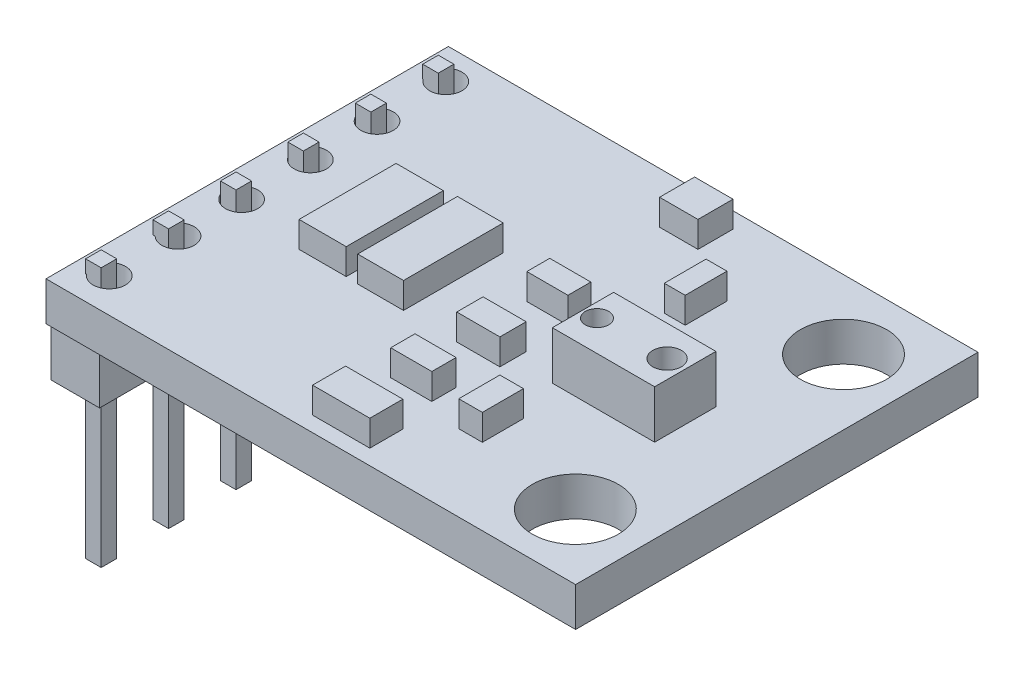
from build123d import *

# Parameters (mm, degrees)
EXTRUDE_START       = -1.5
EXTRUDE_2_OUTLINE_W = 20.4
EXTRUDE_2_OUTLINE_H = 15.5
EXTRUDE_2_DEPTH     = 1.5
SKETCH_4_W          = 1.8168
SKETCH_4_H          = 3.7374
SKETCH_4_W_2        = 1.7648
SKETCH_4_H_2        = 3.8412
SKETCH_4_W_3        = 1.5832
SKETCH_4_H_3        = 0.8824
SKETCH_4_W_4        = 1.4794
SKETCH_4_H_4        = 1.3496
SKETCH_4_W_5        = 0.8046
SKETCH_4_H_5        = 1.609
SKETCH_4_W_6        = 1.661
SKETCH_4_H_6        = 1.0122
SKETCH_4_W_7        = 0.9084
SKETCH_4_H_7        = 1.5832
SKETCH_4_H_8        = 0.9344
SKETCH_4_W_8        = 2.206
SKETCH_4_H_9        = 1.2716
EXTRUDE_3_DEPTH     = 1
SKETCH_4_3_W        = 3.94
SKETCH_4_3_H        = 2.36
EXTRUDE_4_DEPTH     = 1.85
SKETCH_4_4_R        = 0.55
SKETCH_4_4_R_2      = 0.45
CUT_EXTRUDE_1_DEPTH = 2
SKETCH_5_W          = 1.880381038
SKETCH_5_H          = 14.978492058
EXTRUDE_5_DEPTH     = 2
SKETCH_6_W          = 0.6
SKETCH_6_H          = 0.6
EXTRUDE_6_DEPTH     = 6
SKETCH_7_W          = 0.6
SKETCH_7_H          = 0.6
EXTRUDE_7_DEPTH     = 2


# Read off the part's stored shape, not the designer's step: Бобышка-Вытянуть2
with BuildPart() as part:
    # Бобышка-Вытянуть2 outline → Бобышка-Вытянуть2 (new body)
    with BuildSketch(Plane(origin=(0, 0, 0), x_dir=(1, 0, 0), z_dir=(0, 1, 0)).offset(EXTRUDE_START)):
        with Locations((-6.273546654, 0.299402107)):
            Rectangle(EXTRUDE_2_OUTLINE_W, EXTRUDE_2_OUTLINE_H)
        with BuildLine():
            add(Edge.make_bspline(
                [(-15.980346654, -6.127997893), (-15.980346654, -7.206892341), (-15.045996654, -6.667445117), (-14.111646654, -6.127997893), (-15.045996654, -5.588550669), (-15.980346654, -5.049103445), (-15.980346654, -6.127997893)],
                knots=[0, 0, 0, 2.094395102, 2.094395102, 4.188790205, 4.188790205, 6.283185307, 6.283185307, 6.283185307], degree=2, weights=[1, 0.5, 1, 0.5, 1, 0.5, 1]))
        make_face(mode=Mode.SUBTRACT)
        with BuildLine():
            add(Edge.make_bspline(
                [(-15.980346654, -3.480697893), (-15.980346654, -4.559592341), (-15.045996654, -4.020145117), (-14.111646654, -3.480697893), (-15.045996654, -2.941250669), (-15.980346654, -2.401803445), (-15.980346654, -3.480697893)],
                knots=[0, 0, 0, 2.094395102, 2.094395102, 4.188790205, 4.188790205, 6.283185307, 6.283185307, 6.283185307], degree=2, weights=[1, 0.5, 1, 0.5, 1, 0.5, 1]))
        make_face(mode=Mode.SUBTRACT)
        with BuildLine():
            add(Edge.make_bspline(
                [(-15.357446654, -0.407897893), (-16.436341102, -0.407897893), (-15.896893878, -1.342247893), (-15.357446654, -2.276597893), (-14.81799943, -1.342247893), (-14.278552206, -0.407897893), (-15.357446654, -0.407897893)],
                knots=[0, 0, 0, 2.094395102, 2.094395102, 4.188790205, 4.188790205, 6.283185307, 6.283185307, 6.283185307], degree=2, weights=[1, 0.5, 1, 0.5, 1, 0.5, 1]))
        make_face(mode=Mode.SUBTRACT)
        with BuildLine():
            add(Edge.make_bspline(
                [(-0.252046654, -4.943397893), (-0.252046654, -7.820334285), (2.239453346, -6.381866089), (4.730953346, -4.943397893), (2.239453346, -3.504929698), (-0.252046654, -2.066461502), (-0.252046654, -4.943397893)],
                knots=[0, 0, 0, 2.094395102, 2.094395102, 4.188790205, 4.188790205, 6.283185307, 6.283185307, 6.283185307], degree=2, weights=[1, 0.5, 1, 0.5, 1, 0.5, 1]))
        make_face(mode=Mode.SUBTRACT)
        with BuildLine():
            add(Edge.make_bspline(
                [(-15.980346654, 1.616602107), (-15.980346654, 0.537707659), (-15.045996654, 1.077154883), (-14.111646654, 1.616602107), (-15.045996654, 2.156049331), (-15.980346654, 2.695496555), (-15.980346654, 1.616602107)],
                knots=[0, 0, 0, 2.094395102, 2.094395102, 4.188790205, 4.188790205, 6.283185307, 6.283185307, 6.283185307], degree=2, weights=[1, 0.5, 1, 0.5, 1, 0.5, 1]))
        make_face(mode=Mode.SUBTRACT)
        with BuildLine():
            add(Edge.make_bspline(
                [(-15.357446654, 4.808902107), (-16.436341102, 4.808902107), (-15.896893878, 3.874552107), (-15.357446654, 2.940202107), (-14.81799943, 3.874552107), (-14.278552206, 4.808902107), (-15.357446654, 4.808902107)],
                knots=[0, 0, 0, 2.094395102, 2.094395102, 4.188790205, 4.188790205, 6.283185307, 6.283185307, 6.283185307], degree=2, weights=[1, 0.5, 1, 0.5, 1, 0.5, 1]))
        make_face(mode=Mode.SUBTRACT)
        with BuildLine():
            add(Edge.make_bspline(
                [(-15.357446654, 7.456202107), (-16.436341102, 7.456202107), (-15.896893878, 6.521852107), (-15.357446654, 5.587502107), (-14.81799943, 6.521852107), (-14.278552206, 7.456202107), (-15.357446654, 7.456202107)],
                knots=[0, 0, 0, 2.094395102, 2.094395102, 4.188790205, 4.188790205, 6.283185307, 6.283185307, 6.283185307], degree=2, weights=[1, 0.5, 1, 0.5, 1, 0.5, 1]))
        make_face(mode=Mode.SUBTRACT)
        with BuildLine():
            add(Edge.make_bspline(
                [(1.408953346, 7.047502107), (-1.467983045, 7.047502107), (-0.02951485, 4.555852107), (1.408953346, 2.064202107), (2.847421542, 4.555852107), (4.285889738, 7.047502107), (1.408953346, 7.047502107)],
                knots=[0, 0, 0, 2.094395102, 2.094395102, 4.188790205, 4.188790205, 6.283185307, 6.283185307, 6.283185307], degree=2, weights=[1, 0.5, 1, 0.5, 1, 0.5, 1]))
        make_face(mode=Mode.SUBTRACT)
    extrude(amount=EXTRUDE_2_DEPTH)

    # Эскиз4 → Бобышка-Вытянуть3 (add)
    with BuildSketch(Plane(origin=(0, 0, 0), x_dir=(1, 0, 0), z_dir=(0, 1, 0))):
        with Locations((-11.672046654, 0.273502107)):
            Rectangle(SKETCH_4_W, SKETCH_4_H)
        with Locations((-9.414046654, 0.299402107)):
            Rectangle(SKETCH_4_W_2, SKETCH_4_H_2)
        with Locations((-5.663646654, 1.493302107)):
            Rectangle(SKETCH_4_W_3, SKETCH_4_H_3)
        with Locations((-5.637646654, 6.762002107)):
            Rectangle(SKETCH_4_W_4, SKETCH_4_H_4)
        with Locations((-3.016246654, 4.114702107)):
            Rectangle(SKETCH_4_W_5, SKETCH_4_H_5)
        with Locations((-5.624746654, -1.140997893)):
            Rectangle(SKETCH_4_W_6, SKETCH_4_H_6)
        with Locations((-3.068246654, -3.710497893)):
            Rectangle(SKETCH_4_W_7, SKETCH_4_H_7)
        with Locations((-5.741446654, -3.645597893)):
            Rectangle(SKETCH_4_W_3, SKETCH_4_H_8)
        with Locations((-5.689646654, -6.227997893)):
            Rectangle(SKETCH_4_W_8, SKETCH_4_H_9)
    extrude(amount=EXTRUDE_3_DEPTH)

    # Эскиз4<3> → Бобышка-Вытянуть4 (add)
    with BuildSketch(Plane(origin=(0, 0, 0), x_dir=(1, 0, 0), z_dir=(0, 1, 0))):
        with Locations((-1.27, 0)):
            Rectangle(SKETCH_4_3_W, SKETCH_4_3_H)
    extrude(amount=EXTRUDE_4_DEPTH)

    # Эскиз4<4> → Вырез-Вытянуть1 (cut)
    with BuildSketch(Plane(origin=(0, 0, 0), x_dir=(1, 0, 0), z_dir=(0, 1, 0))):
        with Locations(Location((0, 0, 0), (0, 0, 270))):
            Circle(SKETCH_4_4_R)
        with Locations(Location((-2.7, 0, 0), (0, 0, 270))):
            Circle(SKETCH_4_4_R_2)
    extrude(amount=CUT_EXTRUDE_1_DEPTH, mode=Mode.SUBTRACT)

    # Эскиз5 → Бобышка-Вытянуть5 (add)
    with BuildSketch(Plane.XZ.offset(1.5)):
        with Locations((-15.5725, -0.26095)):
            Rectangle(SKETCH_5_W, SKETCH_5_H)
    extrude(amount=EXTRUDE_5_DEPTH)

    # Эскиз6 → Бобышка-Вытянуть6 (add)
    with BuildSketch(Plane.XZ.offset(3.5)):
        with Locations((-15.578372385, -4.167324032)):
            Rectangle(SKETCH_6_W, SKETCH_6_H)
        with Locations((-15.578372385, -6.764457224)):
            Rectangle(SKETCH_6_W, SKETCH_6_H)
        with Locations((-15.578372385, -1.570190841)):
            Rectangle(SKETCH_6_W, SKETCH_6_H)
        with Locations((-15.578372385, 1.026942351)):
            Rectangle(SKETCH_6_W, SKETCH_6_H)
        with Locations((-15.578372385, 3.624075542)):
            Rectangle(SKETCH_6_W, SKETCH_6_H)
        with Locations((-15.578372385, 6.221208734)):
            Rectangle(SKETCH_6_W, SKETCH_6_H)
    extrude(amount=EXTRUDE_6_DEPTH)

    # Эскиз7 → Бобышка-Вытянуть7 (add)
    with BuildSketch(Plane(origin=(0, -1.5, 0), x_dir=(1, 0, 0), z_dir=(0, 1, 0))):
        with Locations((-15.578372385, 1.570190841)):
            Rectangle(SKETCH_7_W, SKETCH_7_H)
        with Locations((-15.578372385, 6.764457224)):
            Rectangle(SKETCH_7_W, SKETCH_7_H)
        with Locations((-15.578372385, 4.167324032)):
            Rectangle(SKETCH_7_W, SKETCH_7_H)
        with Locations((-15.578372385, -6.221208734)):
            Rectangle(SKETCH_7_W, SKETCH_7_H)
        with Locations((-15.578372385, -3.624075542)):
            Rectangle(SKETCH_7_W, SKETCH_7_H)
        with Locations((-15.578372385, -1.026942351)):
            Rectangle(SKETCH_7_W, SKETCH_7_H)
    extrude(amount=EXTRUDE_7_DEPTH)


solid = part.part
